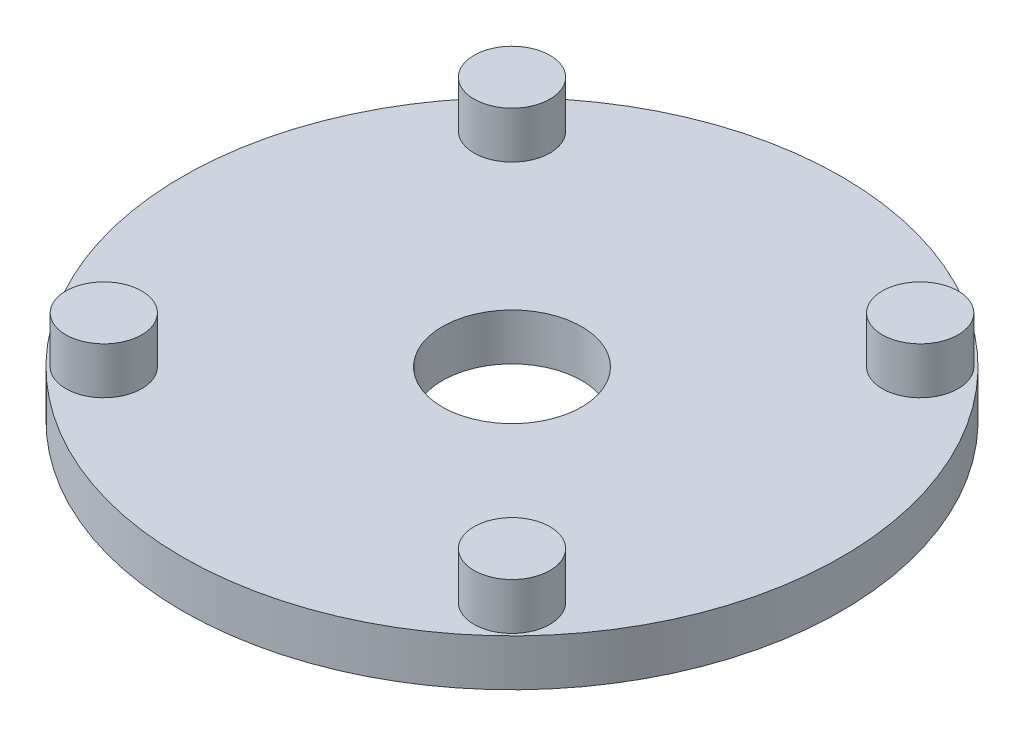
from build123d import *

# Parameters (mm, degrees)
SKETCH1_R           = 29
SKETCH1_R_2         = 6.13
BOSS_EXTRUDE1_DEPTH = 2.055
SKETCH2_R           = 3.34
BOSS_EXTRUDE2_DEPTH = 4.11


with BuildPart() as part:
    # Sketch1 → Boss-Extrude1 (new, symmetric)
    with BuildSketch(Plane(origin=(0, 0, 0), x_dir=(1, 0, 0), z_dir=(0, 1, 0))):
        Circle(SKETCH1_R)
        Circle(SKETCH1_R_2, mode=Mode.SUBTRACT)
    extrude(amount=BOSS_EXTRUDE1_DEPTH, both=True)

    # Sketch2 → Boss-Extrude2 (add)
    with BuildSketch(Plane(origin=(0, 2.055, 0), x_dir=(1, 0, 0), z_dir=(0, 1, 0))):
        with Locations((-17.960512242, 17.960512242)):
            Circle(SKETCH2_R)
        with Locations((-17.960512242, -17.960512242)):
            Circle(SKETCH2_R)
        with Locations((17.960512242, -17.960512242)):
            Circle(SKETCH2_R)
        with Locations((17.960512242, 17.960512242)):
            Circle(SKETCH2_R)
    extrude(amount=BOSS_EXTRUDE2_DEPTH)


solid = part.part
